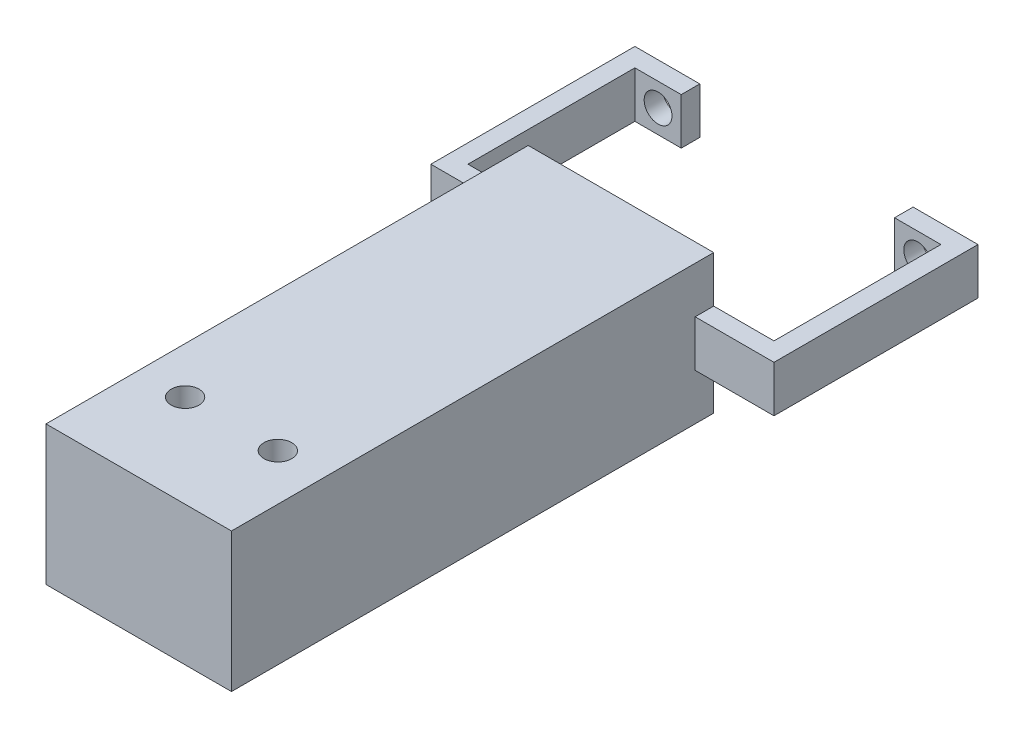
from build123d import *

# Parameters (mm, degrees)
SKETCH_1_R           = 1.5
EXTRUDE_1_DEPTH      = 2
EXTRUDE_1_2_DEPTH    = 2
SKETCH_3_W           = 2
SKETCH_3_H           = 5
EXTRUDE_2_DEPTH      = 18
SKETCH_4_W           = 2
SKETCH_4_H           = 5
EXTRUDE_3_DEPTH      = 37
EXTRUDE_4_DEPTH      = 50
EXTRUDE_4_DEPTH_BACK = 2
SKETCH_6_R           = 1.5
CUT_EXTRUDE_1_DEPTH  = 76.836996249


with BuildPart() as part:
    # Эскиз1 → Бобышка-Вытянуть1 (new body)
    with BuildSketch(Plane.XY):
        Polygon((11.5, 0), (11.5, 2.5), (16.5, 2.5), (18.5, 2.5), (18.5, -2.5), (16.5, -2.5), (11.5, -2.5), align=None)
        with Locations((14, 0)):
            Circle(SKETCH_1_R, mode=Mode.SUBTRACT)
    extrude(amount=EXTRUDE_1_DEPTH)



with BuildPart() as body_2:
    # Эскиз1 → Extrude 1 2 (new body)
    with BuildSketch(Plane.XY):
        Polygon((-16.5, 2.5), (-18.5, 2.5), (-18.5, -2.5), (-16.5, -2.5), (-11.5, -2.5), (-11.5, 0), (-11.5, 2.5), align=None)
        with Locations((-14, 0)):
            Circle(SKETCH_1_R, mode=Mode.SUBTRACT)
    extrude(amount=EXTRUDE_1_2_DEPTH)


with BuildPart() as part_1:
    add(part.part)

    add(body_2.part)  # Бобышка-Вытянуть2 merges body 2
    # Эскиз3 → Бобышка-Вытянуть2 (add)
    with BuildSketch(Plane.XY.offset(2)):
        with Locations((-17.5, 0)):
            Rectangle(SKETCH_3_W, SKETCH_3_H)
        with Locations((17.5, 0)):
            Rectangle(SKETCH_3_W, SKETCH_3_H)
    extrude(amount=EXTRUDE_2_DEPTH)

    # Эскиз4 → Бобышка-Вытянуть3 (add)
    with BuildSketch(Plane(origin=(18.5, 0, 0), x_dir=(0, 0, -1), z_dir=(1, 0, 0))):
        with Locations((-21, 0)):
            Rectangle(SKETCH_4_W, SKETCH_4_H)
    extrude(amount=-EXTRUDE_3_DEPTH)

    # Эскиз5 → Бобышка-Вытянуть4 (add, two sides: drawn at the far end of the back side and taken through both)
    with BuildSketch(Plane.XY.offset(22).offset(-EXTRUDE_4_DEPTH_BACK)):
        Polygon((-10, 2.5), (-10, 7.5), (10, 7.5), (10, -7.5), (-10, -7.5), align=None)
    extrude(amount=EXTRUDE_4_DEPTH + EXTRUDE_4_DEPTH_BACK)

    # Эскиз6 → Вырез-Вытянуть1 (cut, through all)
    with BuildSketch(Plane(origin=(0, 7.5, 0), x_dir=(1, 0, 0), z_dir=(0, 1, 0))):
        with Locations((-5, -62)):
            Circle(SKETCH_6_R)
        with Locations((5, -62)):
            Circle(SKETCH_6_R)
    extrude(amount=-CUT_EXTRUDE_1_DEPTH, mode=Mode.SUBTRACT)


solid = part_1.part
